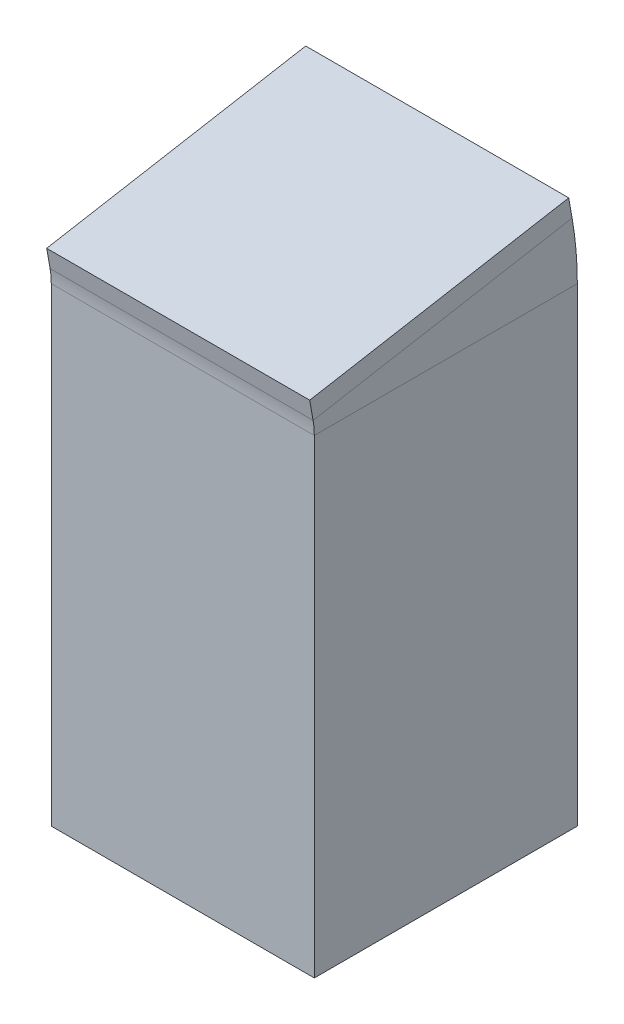
from build123d import *

# Parameters (mm, degrees)
SKETCH1_W              = 25.4
SKETCH1_H              = 50.8
BASE_FLANGE1_DEPTH     = 25.4
SKETCHED_BEND2_DEPTH   = 25.4
SKETCHED_BEND2_2_DEPTH = 25.4


# Read off the part's stored shape, not the designer's step: Sketched Bend2
# Sheet-metal steps are written as plain solids
with BuildPart() as part:
    # Sketch1 → Base-Flange1 (new body)
    with BuildSketch(Plane.XY):
        with Locations((12.7, 25.4)):
            Rectangle(SKETCH1_W, SKETCH1_H)
    extrude(amount=-BASE_FLANGE1_DEPTH)

    # Sketched Bend2 outline → Sketched Bend2 (cut)
    with BuildSketch(Plane.YZ):
        with BuildLine():
            Line((50.8, -25.4), (50.8, -24.950657177))
            ThreePointArc((50.8, -24.950657177), (48.094844213, -25.287472556), (45.37112433, -25.4))
            Line((45.37112433, -25.4), (50.8, -25.4))
        make_face()
        Polygon((50.8, 0), (48.626141092, 0), (50.8, -12.328566501), align=None)
    extrude(amount=SKETCHED_BEND2_DEPTH, mode=Mode.SUBTRACT)

    # Sketched Bend2 2 outline → Sketched Bend2 2 (add)
    with BuildSketch(Plane.YZ):
        with BuildLine():
            Line((52.958756408, -24.57148247), (50.8, -12.328566501))
            Line((50.8, -12.328566501), (50.8, -24.950657177))
            ThreePointArc((50.8, -24.950657177), (50.95255485, -24.924861858), (51.104987157, -24.898352004))
            Line((51.104987157, -24.898352004), (52.958756408, -24.57148247))
        make_face()
        with BuildLine():
            Line((48.548092695, 0.442634457), (46.694323444, 0.115764922))
            ThreePointArc((46.694323444, 0.115764922), (46.03525109, 0.028996401), (45.37112433, 0))
            Line((45.37112433, 0), (48.626141092, 0))
            Line((48.626141092, 0), (48.548092695, 0.442634457))
        make_face()
    extrude(amount=SKETCHED_BEND2_2_DEPTH)


solid = part.part
